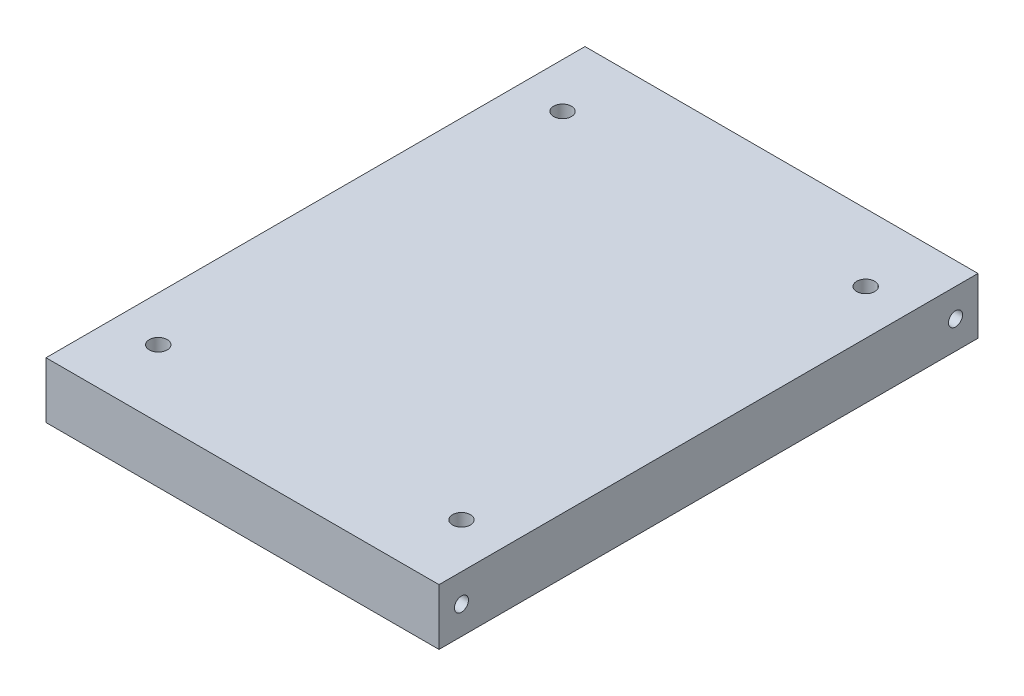
from build123d import *

# Parameters (mm, degrees)
SKETCH1_W           = 70
SKETCH1_H           = 96
SKETCH1_R           = 1.6
BOSS_EXTRUDE1_DEPTH = 10
SKETCH2_R           = 1.25
CUT_EXTRUDE1_DEPTH  = 10


with BuildPart() as part:
    # Sketch1 → Boss-Extrude1 (new body)
    with BuildSketch(Plane.XZ.offset(-316.566699204)):
        with Locations((0, 23.58434623)):
            Rectangle(SKETCH1_W, SKETCH1_H)
        with Locations((-27, 59.58434623)):
            Circle(SKETCH1_R, mode=Mode.SUBTRACT)
        with Locations((27, 59.58434623)):
            Circle(SKETCH1_R, mode=Mode.SUBTRACT)
        with Locations((-27, -12.41565377)):
            Circle(SKETCH1_R, mode=Mode.SUBTRACT)
        with Locations((27, -12.41565377)):
            Circle(SKETCH1_R, mode=Mode.SUBTRACT)
    extrude(amount=BOSS_EXTRUDE1_DEPTH)

    # Sketch2 → Cut-Extrude1 (cut)
    with BuildSketch(Plane.ZY.offset(35)):
        with Locations((-20.41565377, 311.566699204)):
            Circle(SKETCH2_R)
        with Locations((67.58434623, 311.566699204)):
            Circle(SKETCH2_R)
    cut_extrude1 = extrude(amount=-CUT_EXTRUDE1_DEPTH, mode=Mode.SUBTRACT)

    # Mirror1: Cut-Extrude1 across plane
    add(cut_extrude1.mirror(Plane(origin=(0, 0, 0), x_dir=(0, 0, 1), z_dir=(1, 0, 0))), mode=Mode.SUBTRACT)


solid = part.part
